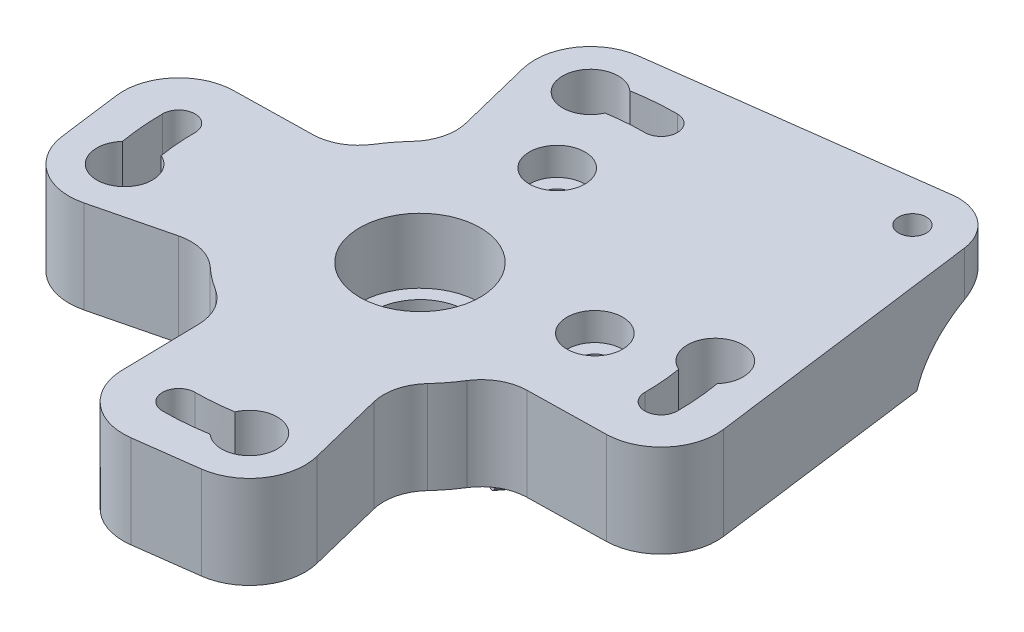
from build123d import *
from build123d.topology import SkipClean

# Parameters (mm, degrees)
SKETCH1_R                = 16
SKETCH1_R_2              = 5
BOSS_EXTRUDE1_DEPTH      = 10
SKETCH8_R                = 6.5
CUT_EXTRUDE7_DEPTH       = 7
SKETCH2_R                = 3
SKETCH2_R_2              = 1.75
BOSS_EXTRUDE2_DEPTH      = 10
CUT_EXTRUDE5_DEPTH       = 38.148351242
SKETCH6_R                = 3
CUT_EXTRUDE6_DEPTH       = 2.5
CHAMFER2_START           = 0.7499999
CHAMFER2_DEPTH           = 1.7500001
FILLET1_R                = 5
CIRPATTERN1_COUNT        = 4
FILLET1_OF_CIRPATTERN1_R = 5
SKETCH9_R                = 22
SKETCH9_R_2              = 10
CUT_EXTRUDE8_DEPTH       = 6
FILLET2_R                = 6
SKETCH11_R               = 1.5
CUT_EXTRUDE9_DEPTH       = 47.346520905
CUT_EXTRUDE10_DEPTH      = 6
BOSS_EXTRUDE8_DEPTH      = 19.627187
BOSS_EXTRUDE8_DEPTH_BACK = 7
SKETCH16_W               = 20
SKETCH16_H               = 10
SKETCH19_R               = 5
CUT_EXTRUDE12_DEPTH      = 47.346520905
SKETCH19_3_R             = 6.5
SKETCH19_3_R_2           = 5
CUT_EXTRUDE13_DEPTH      = 7
BOSS_EXTRUDE9_START      = -4
BOSS_EXTRUDE9_DEPTH      = 10
SKETCH21_R               = 1.5
CUT_EXTRUDE15_DEPTH      = 47.346520905
BOSS_EXTRUDE11_START     = -10
BOSS_EXTRUDE11_DEPTH     = 10
SKETCH25_R               = 8
CUT_EXTRUDE16_DEPTH      = 54.152115825
BOSS_EXTRUDE12_DEPTH     = 6
REVOLVE1_ANGLE           = 180
BOSS_EXTRUDE13_DEPTH     = 2
SKETCH30_R               = 3
CUT_EXTRUDE17_DEPTH      = 3


with BuildPart() as part:
    # Sketch1 → Boss-Extrude1 (new body)
    with BuildSketch(Plane(origin=(0, 0, 0), x_dir=(1, 0, 0), z_dir=(0, 1, 0))):
        with Locations(Location((0, 0, 0), (0, 0, 270))):
            Circle(SKETCH1_R)
        with Locations(Location((0, 0, 0), (0, 0, 270))):
            Circle(SKETCH1_R_2, mode=Mode.SUBTRACT)
    extrude(amount=BOSS_EXTRUDE1_DEPTH)

    # Sketch8 → Cut-Extrude7 (cut)
    with BuildSketch(Plane(origin=(0, 10, 0), x_dir=(1, 0, 0), z_dir=(0, 1, 0))):
        with Locations(Location((0, 0, 0), (0, 0, 270))):
            Circle(SKETCH8_R)
    extrude(amount=-CUT_EXTRUDE7_DEPTH, mode=Mode.SUBTRACT)

    # Sketch2 → Boss-Extrude2 (add)
    with BuildSketch(Plane(origin=(0, 0, 0), x_dir=(1, 0, 0), z_dir=(0, 1, 0))):
        with BuildLine():
            Line((-7.512452326, 31.062740652), (-0.783157153, 31.948669168))
            ThreePointArc((-0.783157153, 31.948669168), (3.91251461, 30.548871226), (5.99889043, 26.115384615))
            Line((5.99889043, 26.115384615), (6.217640437, 14.742487829))
            Line((6.217640437, 14.742487829), (-9.821416099, 12.630905978))
            Line((-9.821416099, 12.630905978), (-12.553642104, 23.672897371))
            ThreePointArc((-12.553642104, 23.672897371), (-11.685828587, 28.495310386), (-7.512452326, 31.062740652))
        make_face()
        with Locations(Location((-6.729295173, 25.114071484, 0), (0, 0, 270))):
            Circle(SKETCH2_R, mode=Mode.SUBTRACT)
        with Locations(Location((0, 26, 0), (0, 0, 270))):
            Circle(SKETCH2_R_2, mode=Mode.SUBTRACT)
    boss_extrude2 = extrude(amount=BOSS_EXTRUDE2_DEPTH)

    # Sketch5 → Cut-Extrude5 (cut, through all)
    with BuildSketch(Plane(origin=(0, 0, 0), x_dir=(1, 0, 0), z_dir=(0, 1, 0))):
        with BuildLine():
            ThreePointArc((0, 27.75), (-3.622101834, 27.512594903), (-7.182228502, 26.80444168))
            ThreePointArc((-7.182228502, 26.80444168), (-8.419665369, 24.661138155), (-6.276361844, 23.423701288))
            ThreePointArc((-6.276361844, 23.423701288), (-3.165260161, 24.042537888), (0, 24.25))
            ThreePointArc((0, 24.25), (1.75, 26), (0, 27.75))
        make_face()
    cut_extrude5 = extrude(amount=CUT_EXTRUDE5_DEPTH, mode=Mode.SUBTRACT)

    # Sketch6 → Cut-Extrude6 (cut)
    with BuildSketch(Plane(origin=(0, 0, 0), x_dir=(1, 0, 0), z_dir=(0, 1, 0))):
        with Locations((0, 26)):
            Circle(SKETCH6_R)
    cut_extrude6 = extrude(amount=CUT_EXTRUDE6_DEPTH, mode=Mode.SUBTRACT)

    # Chamfer2: read off the stored shape, not the designer's step
    # Chamfer2 outline → Chamfer2 (add)
    with SkipClean():  # the faces are left unmerged after this step: merging them gives an invalid solid
        with BuildSketch(Plane(origin=(0, 0, 0), x_dir=(1, 0, 0), z_dir=(0, 1, 0)).offset(CHAMFER2_START)):
            with BuildLine():
                ThreePointArc((0, 24.25), (-1.176632969, 24.221437506), (-2.35049418, 24.135817307))
                ThreePointArc((-2.35049418, 24.135817307), (2.996700707, 26.140658707), (-2.514776677, 27.635817308))
                ThreePointArc((-2.514776677, 27.635817308), (-1.258683779, 27.72143963), (0, 27.75))
                ThreePointArc((0, 27.75), (1.75, 26), (0, 24.25))
            make_face()
        chamfer2 = extrude(amount=CHAMFER2_DEPTH)
    add(part.part.scale(1), mode=Mode.REPLACE)  # the faces are merged on a copy

    # Chamfer2 2 outline → Chamfer2 2 (revolve, cut)
    with BuildSketch(Plane.XY.offset(-26)):
        Polygon((3, 0.75), (1.749995826, 2.000004174), (1.749995826, 0.7499999), align=None)
    chamfer2_2 = revolve(axis=Axis((0, 0, -26), (0, 1, 0)), mode=Mode.SUBTRACT)

    # Fillet1
    fillet1_edges = [part.edges().sort_by_distance(p)[0] for p in [
        (6.217640437, 5, -14.742487829),
        (-9.821416099, 5, -12.630905978),
    ]]
    fillet(fillet1_edges, radius=FILLET1_R)

    # CirPattern1: Boss-Extrude2, Cut-Extrude5, Cut-Extrude6, Chamfer2, Chamfer2 2 ×4 about axis
    with SkipClean():  # the faces are left unmerged after this step: merging them gives an invalid solid
        cirpattern1_axis = Axis((0, 0, 0), (0, 1, 0))
        add([boss_extrude2.rotate(cirpattern1_axis, i * 360 / CIRPATTERN1_COUNT) for i in range(1, CIRPATTERN1_COUNT)])
        add([cut_extrude5.rotate(cirpattern1_axis, i * 360 / CIRPATTERN1_COUNT) for i in range(1, CIRPATTERN1_COUNT)], mode=Mode.SUBTRACT)
        add([cut_extrude6.rotate(cirpattern1_axis, i * 360 / CIRPATTERN1_COUNT) for i in range(1, CIRPATTERN1_COUNT)], mode=Mode.SUBTRACT)
        add([chamfer2.rotate(cirpattern1_axis, i * 360 / CIRPATTERN1_COUNT) for i in range(1, CIRPATTERN1_COUNT)])
        add([chamfer2_2.rotate(cirpattern1_axis, i * 360 / CIRPATTERN1_COUNT) for i in range(1, CIRPATTERN1_COUNT)], mode=Mode.SUBTRACT)
    add(part.part.scale(1), mode=Mode.REPLACE)  # the faces are merged on a copy

    # Fillet1 of CirPattern1
    fillet1_of_cirpattern1_edges = [part.edges().sort_by_distance(p)[0] for p in [
        (-14.742487829, 5, -6.217640437),
        (-12.630905978, 5, 9.821416099),
        (-6.217640437, 5, 14.742487829),
        (9.821416099, 5, 12.630905978),
        (14.742487829, 5, 6.217640437),
        (12.630905978, 5, -9.821416099),
    ]]
    fillet(fillet1_of_cirpattern1_edges, radius=FILLET1_OF_CIRPATTERN1_R)

    # Sketch9 → Cut-Extrude8 (cut)
    with BuildSketch(Plane(origin=(0, 0, 0), x_dir=(1, 0, 0), z_dir=(0, 1, 0))):
        Circle(SKETCH9_R)
        with Locations(Location((0, 0, 0), (0, 0, 270))):
            Circle(SKETCH9_R_2, mode=Mode.SUBTRACT)
    extrude(amount=CUT_EXTRUDE8_DEPTH, mode=Mode.SUBTRACT)

    # Fillet2
    # the kernel refuses this fillet: 6 mm, written as the material it takes off along each edge
    with BuildSketch(Plane(origin=(-11.358105957, 6, -18.841269306), x_dir=(-0.24019568546626038, 0, -0.970724488556559), z_dir=(0, -1, 0)), Plane(origin=(-18.841269306, 6, 11.358105957), x_dir=(-0.970724488556559, 0, 0.24019568546626072), z_dir=(0, -1, 0)), Plane(origin=(18.841269306, 6, -11.358105957), x_dir=(0.9707244885565594, 0, -0.24019568546625922), z_dir=(0, -1, 0)), Plane(origin=(11.358105957, 6, 18.841269306), x_dir=(0.24019568546625802, 0, 0.9707244885565596), z_dir=(0, -1, 0))) as fillet2_piece_1:
        with BuildLine():
            CenterArc((6.969535845, 5.659608194), FILLET2_R, 178.280066573, 72.327761741)
            ThreePointArc((0.972238973, 5.839692152), (0.683445006, 2.886993735), (0, 0))
            Line((0, 0), (4.977342306, 0))
        make_face()
    extrude(amount=20.80018012, mode=Mode.SUBTRACT)
    with BuildSketch(Plane(origin=(6.094608551, 6, -21.138962761), x_dir=(-0.9893982849393695, 0, -0.1452275241097026), z_dir=(0, -1, 0)), Plane(origin=(-21.138962761, 6, -6.094608551), x_dir=(-0.14522752410970335, 0, 0.9893982849393694), z_dir=(0, -1, 0)), Plane(origin=(21.138962761, 6, 6.094608551), x_dir=(0.1452275241097043, 0, -0.9893982849393692), z_dir=(0, -1, 0)), Plane(origin=(-6.094608551, 6, 21.138962761), x_dir=(0.9893982849393691, 0, 0.14522752410970535), z_dir=(0, -1, 0))) as fillet2_piece_2:
        with BuildLine():
            CenterArc((6.7273546, 5.945443203), FILLET2_R, 189.939807021, 72.327761741)
            Line((0.81741677, 4.909762342), (0, 0))
            ThreePointArc((0, 0), (2.960036024, 0.200041589), (5.920072048, 0))
        make_face()
    extrude(amount=20.80018012, mode=Mode.SUBTRACT)

    # Sketch11 → Cut-Extrude9 (cut, through all)
    with BuildSketch(Plane(origin=(0, 10, 0), x_dir=(1, 0, 0), z_dir=(0, 1, 0))):
        with Locations(Location((-1.421749595, 16.216615803, 0), (0, 0, 270))):
            Circle(SKETCH11_R)
        with Locations(Location((16.032023891, 2.823864364, 0), (0, 0, 270))):
            Circle(SKETCH11_R)
    extrude(amount=-CUT_EXTRUDE9_DEPTH, mode=Mode.SUBTRACT)

    # Sketch12 → Cut-Extrude10 (cut)
    with BuildSketch(Plane.XZ):
        with BuildLine():
            Line((-1.404346095, -9.900899557), (9.927006101, -1.206047207))
            ThreePointArc((9.927006101, -1.206047207), (6.08761429, -7.933533403), (-1.404346095, -9.900899557))
        make_face()
    extrude(amount=-CUT_EXTRUDE10_DEPTH, mode=Mode.SUBTRACT)

    # Sketch16 → Boss-Extrude8 (add, two sides: drawn at the far end of the back side and taken through both)
    with BuildSketch(Plane(origin=(4.261330003, 0, -5.553473382), x_dir=(-0.7933533402912363, 0, -0.6087614290087193), z_dir=(0.6087614290087192, 0, -0.7933533402912362)).offset(-BOSS_EXTRUDE8_DEPTH_BACK)):
        with Locations((0, 5)):
            Rectangle(SKETCH16_W, SKETCH16_H)
    extrude(amount=BOSS_EXTRUDE8_DEPTH + BOSS_EXTRUDE8_DEPTH_BACK)

    # Sketch19 → Cut-Extrude12 (cut, through all)
    with SkipClean():  # the faces are left unmerged after this step: merging them gives an invalid solid
        with BuildSketch(Plane(origin=(0, 10, 0), x_dir=(1, 0, 0), z_dir=(0, 1, 0))):
            with Locations(Location((0, 0, 0), (0, 0, 142.5))):
                Circle(SKETCH19_R)
        extrude(amount=-CUT_EXTRUDE12_DEPTH, mode=Mode.SUBTRACT)

    # Sketch19<3> → Cut-Extrude13 (cut)
    with BuildSketch(Plane(origin=(0, 10, 0), x_dir=(1, 0, 0), z_dir=(0, 1, 0))):
        with Locations(Location((0, 0, 0), (0, 0, 270))):
            Circle(SKETCH19_3_R)
        with Locations(Location((0, 0, 0), (0, 0, 270))):
            Circle(SKETCH19_3_R_2, mode=Mode.SUBTRACT)
    extrude(amount=-CUT_EXTRUDE13_DEPTH, mode=Mode.SUBTRACT)

    # Sketch22 → Boss-Extrude9 (add)
    with BuildSketch(Plane.XZ.offset(-6).offset(BOSS_EXTRUDE9_START)):
        with BuildLine():
            Line((3.652568574, -30.760120042), (28.766640058, -11.489415214))
            ThreePointArc((28.766640058, -11.489415214), (26.34114568, -12.602479055), (23.672897371, -12.553642104))
            ThreePointArc((23.672897371, -12.553642104), (21.347832311, -9.643979794), (21.187714345, -5.922901386))
            ThreePointArc((21.187714345, -5.922901386), (21.81178695, -2.871576229), (21.998720167, 0.23729942))
            ThreePointArc((21.998720167, 0.23729942), (22.602900702, 2.926688653), (24.345802548, 5.062137486))
            Line((24.345802548, 5.062137486), (-11.190806701, -22.206061852))
            ThreePointArc((-11.190806701, -22.206061852), (-8.677025331, -21.075242775), (-5.922901386, -21.187714345))
            ThreePointArc((-5.922901386, -21.187714345), (-2.871576229, -21.81178695), (0.23729942, -21.998720167))
            ThreePointArc((0.23729942, -21.998720167), (3.790143578, -23.116468206), (5.99889043, -26.115384615))
            ThreePointArc((5.99889043, -26.115384615), (5.355469823, -28.705354501), (3.652568574, -30.760120042))
        make_face()
    extrude(amount=BOSS_EXTRUDE9_DEPTH)

    # Sketch21 → Cut-Extrude15 (cut, through all)
    with SkipClean():  # the faces are left unmerged after this step: merging them gives an invalid solid
        with BuildSketch(Plane(origin=(0, 10, 0), x_dir=(1, 0, 0), z_dir=(0, 1, 0))):
            with Locations(Location((-1.421749595, 16.216615803, 0), (0, 0, 270))):
                Circle(SKETCH21_R)
            with Locations(Location((16.032023891, 2.823864364, 0), (0, 0, 270))):
                Circle(SKETCH21_R)
        extrude(amount=-CUT_EXTRUDE15_DEPTH, mode=Mode.SUBTRACT)
    add(part.part.scale(1), mode=Mode.REPLACE)  # the faces are merged on a copy

    # Sketch24 → Boss-Extrude11 (add)
    with BuildSketch(Plane(origin=(0, 10, 0), x_dir=(1, 0, 0), z_dir=(0, 1, 0)).offset(BOSS_EXTRUDE11_START)):
        with BuildLine():
            ThreePointArc((28.010531131, 30.696285343), (27.383433844, 32.543654382), (26.09711397, 34.010421083))
            Line((26.09711397, 34.010421083), (23.966448968, 31.233684392))
            ThreePointArc((23.966448968, 31.233684392), (24.398615937, 30.707087417), (24.553306825, 30.043654382))
            ThreePointArc((24.553306825, 30.043654382), (23.71673986, 28.698345269), (22.140164681, 28.853624371))
            Line((22.140164681, 28.853624371), (16.209604316, 21.124767628))
            Line((16.209604316, 21.124767628), (28.766640058, 11.489415214))
            ThreePointArc((28.766640058, 11.489415214), (30.310223906, 9.729295173), (31.062740652, 7.512452326))
            Line((31.062740652, 7.512452326), (28.010531131, 30.696285343))
        make_face()
        with BuildLine():
            Line((22.400675863, 35.000878689), (-0.783157153, 31.948669168))
            ThreePointArc((-0.783157153, 31.948669168), (1.552914271, 31.795554958), (3.652568574, 30.760120042))
            Line((3.652568574, 30.760120042), (16.209604316, 21.124767628))
            Line((16.209604316, 21.124767628), (22.140164681, 28.853624371))
            ThreePointArc((22.140164681, 28.853624371), (21.863276814, 30.956796525), (23.966448968, 31.233684392))
            Line((23.966448968, 31.233684392), (26.09711397, 34.010421083))
            ThreePointArc((26.09711397, 34.010421083), (24.34740205, 34.873283513), (22.400675863, 35.000878689))
        make_face()
    extrude(amount=BOSS_EXTRUDE11_DEPTH)

    # Sketch25 → Cut-Extrude16 (cut, through all)
    with BuildSketch(Plane(origin=(4.261330003, 0, -5.553473382), x_dir=(0.7933533402912363, 0, 0.6087614290087192), z_dir=(-0.6087614290087192, 0, 0.7933533402912363))):
        with Locations((0, -2)):
            Circle(SKETCH25_R)
    extrude(amount=-CUT_EXTRUDE16_DEPTH, mode=Mode.SUBTRACT)

    # Sketch26 → Boss-Extrude12 (add)
    with BuildSketch(Plane.XZ.offset(-6)):
        with BuildLine():
            Line((7.933533403, 6.08761429), (14.511031326, -2.484347893))
            Line((14.511031326, -2.484347893), (14.585398957, -2.427283602))
            ThreePointArc((14.585398957, -2.427283602), (15.118881748, -1.633834354), (16.023370375, -1.323889326))
            Line((16.023370375, -1.323889326), (24.345802548, 5.062137486))
            ThreePointArc((24.345802548, 5.062137486), (25.191242868, 5.604849798), (26.115384615, 5.99889043))
            Line((26.115384615, 5.99889043), (17.693033963, 6.16088867))
            ThreePointArc((17.693033963, 6.16088867), (15.327070116, 6.808185487), (13.553666902, 8.502829736))
            ThreePointArc((13.553666902, 8.502829736), (12.693653445, 9.740182864), (11.721049963, 10.891142629))
            ThreePointArc((11.721049963, 10.891142629), (10.543139844, 13.0427248), (10.530255634, 15.495603127))
            Line((10.530255634, 15.495603127), (12.553642104, 23.672897371))
            ThreePointArc((12.553642104, 23.672897371), (9.643979794, 21.347832311), (5.922901386, 21.187714345))
            ThreePointArc((5.922901386, 21.187714345), (2.871576229, 21.81178695), (-0.23729942, 21.998720167))
            ThreePointArc((-0.23729942, 21.998720167), (-3.790143578, 23.116468206), (-5.99889043, 26.115384615))
            Line((-5.99889043, 26.115384615), (-6.16088867, 17.693033963))
            ThreePointArc((-6.16088867, 17.693033963), (-6.808185487, 15.327070116), (-8.502829736, 13.553666902))
            ThreePointArc((-8.502829736, 13.553666902), (-9.740182864, 12.693653445), (-10.891142629, 11.721049963))
            ThreePointArc((-10.891142629, 11.721049963), (-13.0427248, 10.543139844), (-15.495603127, 10.530255634))
            Line((-15.495603127, 10.530255634), (-23.672897371, 12.553642104))
            ThreePointArc((-23.672897371, 12.553642104), (-21.347832311, 9.643979794), (-21.187714345, 5.922901386))
            ThreePointArc((-21.187714345, 5.922901386), (-21.81178695, 2.871576229), (-21.998720167, -0.23729942))
            ThreePointArc((-21.998720167, -0.23729942), (-23.116468206, -3.790143578), (-26.115384615, -5.99889043))
            Line((-26.115384615, -5.99889043), (-17.693033963, -6.16088867))
            ThreePointArc((-17.693033963, -6.16088867), (-15.327070116, -6.808185487), (-13.553666902, -8.502829736))
            ThreePointArc((-13.553666902, -8.502829736), (-12.693653445, -9.740182864), (-11.721049963, -10.891142629))
            ThreePointArc((-11.721049963, -10.891142629), (-10.543139844, -13.0427248), (-10.530255634, -15.495603127))
            Line((-10.530255634, -15.495603127), (-12.553642104, -23.672897371))
            ThreePointArc((-12.553642104, -23.672897371), (-11.933842596, -22.88223021), (-11.190806701, -22.206061852))
            Line((-11.190806701, -22.206061852), (-2.868374529, -15.820035041))
            ThreePointArc((-2.868374529, -15.820035041), (-2.334891739, -15.026585792), (-1.430403111, -14.716640764))
            Line((-1.430403111, -14.716640764), (-1.35603548, -14.659576473))
            Line((-1.35603548, -14.659576473), (-7.933533403, -6.08761429))
            ThreePointArc((-7.933533403, -6.08761429), (-6.08761429, 7.933533403), (7.933533403, 6.08761429))
        make_face()
    extrude(amount=BOSS_EXTRUDE12_DEPTH)



with BuildPart() as body_2:
    # Sketch27 → Revolve1 (revolve)
    with BuildSketch(Plane(origin=(0, -2, 0), x_dir=(1, 0, 0), z_dir=(0, 1, 0))):
        Polygon((4.261330003, 5.553473382), (3.043807145, 3.966766701), (9.390633867, -0.903324731), (10.608156725, 0.68338195), align=None)
    revolve(axis=Axis((4.261330003, -2, -5.553473382), (0.6087614290087197, 0, -0.793353340291236)), revolution_arc=REVOLVE1_ANGLE)


with BuildPart() as part_1:
    add(part.part)

    add(body_2.part)  # Boss-Extrude13 merges body 2
    # Sketch29 → Boss-Extrude13 (add)
    with BuildSketch(Plane(origin=(0, -2, 0), x_dir=(1, 0, 0), z_dir=(0, 1, 0))):
        Polygon((10.608156725, 0.68338195), (-2.085496719, 10.423564814), (-3.303019577, 8.836858134), (9.390633867, -0.903324731), align=None)
    extrude(amount=BOSS_EXTRUDE13_DEPTH)

    # Sketch30 → Cut-Extrude17 (cut)
    with BuildSketch(Plane(origin=(0, 10, 0), x_dir=(1, 0, 0), z_dir=(0, 1, 0))):
        with Locations(Location((-1.421749595, 16.216615803, 0), (0, 0, 270))):
            Circle(SKETCH30_R)
        with Locations(Location((16.032023891, 2.823864364, 0), (0, 0, 270))):
            Circle(SKETCH30_R)
    extrude(amount=-CUT_EXTRUDE17_DEPTH, mode=Mode.SUBTRACT)


solid = part_1.part
